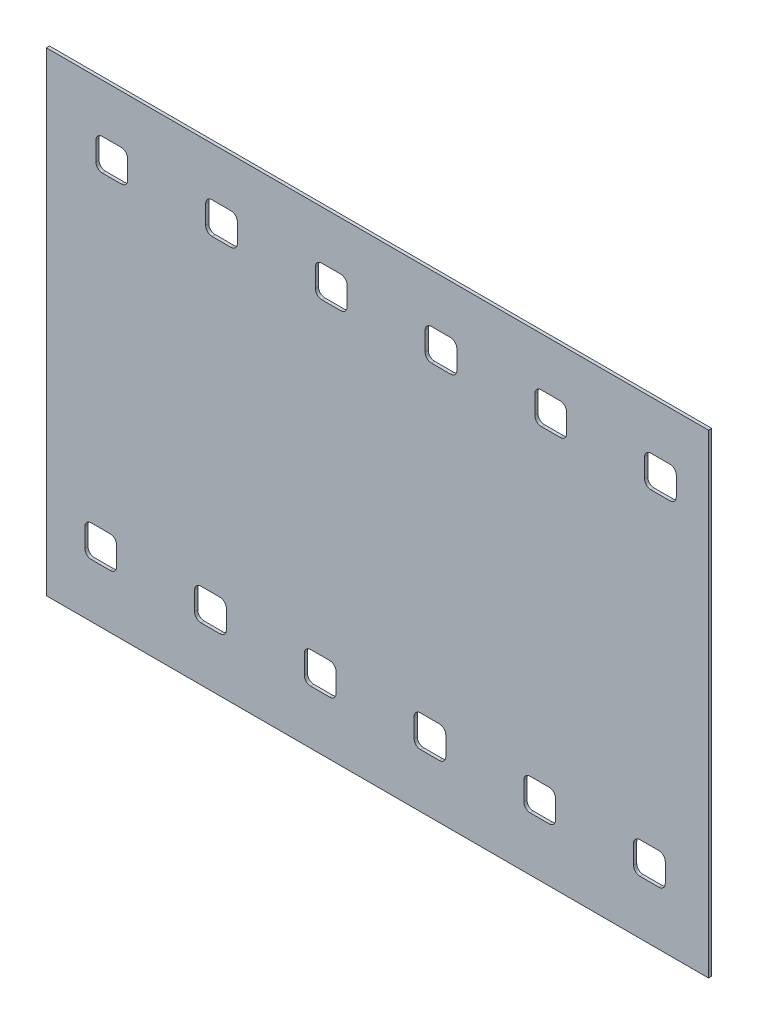
from build123d import *

# Parameters (mm, degrees)
SKETCH1_W               = 663.575
SKETCH1_H               = 475.54896
BASE_FLANGE1_DEPTH      = 3.175
CUT_EXTRUDE1_DEPTH      = 409.203048887
CUT_EXTRUDE1_DEPTH_BACK = 409.203048887


# Sheet-metal steps are written as plain solids
with BuildPart() as part:
    # Sketch1 → Base-Flange1 (new body)
    with BuildSketch(Plane.XY):
        Rectangle(SKETCH1_W, SKETCH1_H)
    extrude(amount=-BASE_FLANGE1_DEPTH)

    # Sketch6 → Cut-Extrude1 (cut, two sides: drawn at the far end of the back side and taken through both)
    with BuildSketch(Plane.XY.offset(-CUT_EXTRUDE1_DEPTH_BACK)):
        with BuildLine():
            Line((263.0805, -152.04948), (282.1305, -152.04948))
            ThreePointArc((282.1305, -152.04948), (286.620628061, -153.909351939), (288.4805, -158.39948))
            Line((288.4805, -158.39948), (288.4805, -177.44948))
            ThreePointArc((288.4805, -177.44948), (286.620628061, -181.939608061), (282.1305, -183.79948))
            Line((282.1305, -183.79948), (263.0805, -183.79948))
            ThreePointArc((263.0805, -183.79948), (258.590371939, -181.939608061), (256.7305, -177.44948))
            Line((256.7305, -177.44948), (256.7305, -158.39948))
            ThreePointArc((256.7305, -158.39948), (258.590371939, -153.909351939), (263.0805, -152.04948))
        make_face()
        with BuildLine():
            Line((153.0985, -152.04948), (172.1485, -152.04948))
            ThreePointArc((172.1485, -152.04948), (176.638628061, -153.909351939), (178.4985, -158.39948))
            Line((178.4985, -158.39948), (178.4985, -177.44948))
            ThreePointArc((178.4985, -177.44948), (176.638628061, -181.939608061), (172.1485, -183.79948))
            Line((172.1485, -183.79948), (153.0985, -183.79948))
            ThreePointArc((153.0985, -183.79948), (148.608371939, -181.939608061), (146.7485, -177.44948))
            Line((146.7485, -177.44948), (146.7485, -158.39948))
            ThreePointArc((146.7485, -158.39948), (148.608371939, -153.909351939), (153.0985, -152.04948))
        make_face()
        with BuildLine():
            Line((43.1165, -152.04948), (62.1665, -152.04948))
            ThreePointArc((62.1665, -152.04948), (66.656628061, -153.909351939), (68.5165, -158.39948))
            Line((68.5165, -158.39948), (68.5165, -177.44948))
            ThreePointArc((68.5165, -177.44948), (66.656628061, -181.939608061), (62.1665, -183.79948))
            Line((62.1665, -183.79948), (43.1165, -183.79948))
            ThreePointArc((43.1165, -183.79948), (38.626371939, -181.939608061), (36.7665, -177.44948))
            Line((36.7665, -177.44948), (36.7665, -158.39948))
            ThreePointArc((36.7665, -158.39948), (38.626371939, -153.909351939), (43.1165, -152.04948))
        make_face()
        with BuildLine():
            Line((-66.8655, -152.04948), (-47.8155, -152.04948))
            ThreePointArc((-47.8155, -152.04948), (-43.325371939, -153.909351939), (-41.4655, -158.39948))
            Line((-41.4655, -158.39948), (-41.4655, -177.44948))
            ThreePointArc((-41.4655, -177.44948), (-43.325371939, -181.939608061), (-47.8155, -183.79948))
            Line((-47.8155, -183.79948), (-66.8655, -183.79948))
            ThreePointArc((-66.8655, -183.79948), (-71.355628061, -181.939608061), (-73.2155, -177.44948))
            Line((-73.2155, -177.44948), (-73.2155, -158.39948))
            ThreePointArc((-73.2155, -158.39948), (-71.355628061, -153.909351939), (-66.8655, -152.04948))
        make_face()
        with BuildLine():
            Line((-176.8475, -152.04948), (-157.7975, -152.04948))
            ThreePointArc((-157.7975, -152.04948), (-153.307371939, -153.909351939), (-151.4475, -158.39948))
            Line((-151.4475, -158.39948), (-151.4475, -177.44948))
            ThreePointArc((-151.4475, -177.44948), (-153.307371939, -181.939608061), (-157.7975, -183.79948))
            Line((-157.7975, -183.79948), (-176.8475, -183.79948))
            ThreePointArc((-176.8475, -183.79948), (-181.337628061, -181.939608061), (-183.1975, -177.44948))
            Line((-183.1975, -177.44948), (-183.1975, -158.39948))
            ThreePointArc((-183.1975, -158.39948), (-181.337628061, -153.909351939), (-176.8475, -152.04948))
        make_face()
        with BuildLine():
            Line((-286.8295, -152.04948), (-267.7795, -152.04948))
            ThreePointArc((-267.7795, -152.04948), (-263.289371939, -153.909351939), (-261.4295, -158.39948))
            Line((-261.4295, -158.39948), (-261.4295, -177.44948))
            ThreePointArc((-261.4295, -177.44948), (-263.289371939, -181.939608061), (-267.7795, -183.79948))
            Line((-267.7795, -183.79948), (-286.8295, -183.79948))
            ThreePointArc((-286.8295, -183.79948), (-291.319628061, -181.939608061), (-293.1795, -177.44948))
            Line((-293.1795, -177.44948), (-293.1795, -158.39948))
            ThreePointArc((-293.1795, -158.39948), (-291.319628061, -153.909351939), (-286.8295, -152.04948))
        make_face()
        with BuildLine():
            Line((-275.7805, 188.87948), (-256.7305, 188.87948))
            ThreePointArc((-256.7305, 188.87948), (-252.240371939, 187.019608061), (-250.3805, 182.52948))
            Line((-250.3805, 182.52948), (-250.3805, 163.47948))
            ThreePointArc((-250.3805, 163.47948), (-252.240371939, 158.989351939), (-256.7305, 157.12948))
            Line((-256.7305, 157.12948), (-275.7805, 157.12948))
            ThreePointArc((-275.7805, 157.12948), (-280.270628061, 158.989351939), (-282.1305, 163.47948))
            Line((-282.1305, 163.47948), (-282.1305, 182.52948))
            ThreePointArc((-282.1305, 182.52948), (-280.270628061, 187.019608061), (-275.7805, 188.87948))
        make_face()
        with BuildLine():
            Line((-165.7985, 188.87948), (-146.7485, 188.87948))
            ThreePointArc((-146.7485, 188.87948), (-142.258371939, 187.019608061), (-140.3985, 182.52948))
            Line((-140.3985, 182.52948), (-140.3985, 163.47948))
            ThreePointArc((-140.3985, 163.47948), (-142.258371939, 158.989351939), (-146.7485, 157.12948))
            Line((-146.7485, 157.12948), (-165.7985, 157.12948))
            ThreePointArc((-165.7985, 157.12948), (-170.288628061, 158.989351939), (-172.1485, 163.47948))
            Line((-172.1485, 163.47948), (-172.1485, 182.52948))
            ThreePointArc((-172.1485, 182.52948), (-170.288628061, 187.019608061), (-165.7985, 188.87948))
        make_face()
        with BuildLine():
            Line((-55.8165, 188.87948), (-36.7665, 188.87948))
            ThreePointArc((-36.7665, 188.87948), (-32.276371939, 187.019608061), (-30.4165, 182.52948))
            Line((-30.4165, 182.52948), (-30.4165, 163.47948))
            ThreePointArc((-30.4165, 163.47948), (-32.276371939, 158.989351939), (-36.7665, 157.12948))
            Line((-36.7665, 157.12948), (-55.8165, 157.12948))
            ThreePointArc((-55.8165, 157.12948), (-60.306628061, 158.989351939), (-62.1665, 163.47948))
            Line((-62.1665, 163.47948), (-62.1665, 182.52948))
            ThreePointArc((-62.1665, 182.52948), (-60.306628061, 187.019608061), (-55.8165, 188.87948))
        make_face()
        with BuildLine():
            Line((54.1655, 188.87948), (73.2155, 188.87948))
            ThreePointArc((73.2155, 188.87948), (77.705628061, 187.019608061), (79.5655, 182.52948))
            Line((79.5655, 182.52948), (79.5655, 163.47948))
            ThreePointArc((79.5655, 163.47948), (77.705628061, 158.989351939), (73.2155, 157.12948))
            Line((73.2155, 157.12948), (54.1655, 157.12948))
            ThreePointArc((54.1655, 157.12948), (49.675371939, 158.989351939), (47.8155, 163.47948))
            Line((47.8155, 163.47948), (47.8155, 182.52948))
            ThreePointArc((47.8155, 182.52948), (49.675371939, 187.019608061), (54.1655, 188.87948))
        make_face()
        with BuildLine():
            Line((164.1475, 188.87948), (183.1975, 188.87948))
            ThreePointArc((183.1975, 188.87948), (187.687628061, 187.019608061), (189.5475, 182.52948))
            Line((189.5475, 182.52948), (189.5475, 163.47948))
            ThreePointArc((189.5475, 163.47948), (187.687628061, 158.989351939), (183.1975, 157.12948))
            Line((183.1975, 157.12948), (164.1475, 157.12948))
            ThreePointArc((164.1475, 157.12948), (159.657371939, 158.989351939), (157.7975, 163.47948))
            Line((157.7975, 163.47948), (157.7975, 182.52948))
            ThreePointArc((157.7975, 182.52948), (159.657371939, 187.019608061), (164.1475, 188.87948))
        make_face()
        with BuildLine():
            Line((274.1295, 188.87948), (293.1795, 188.87948))
            ThreePointArc((293.1795, 188.87948), (297.669628061, 187.019608061), (299.5295, 182.52948))
            Line((299.5295, 182.52948), (299.5295, 163.47948))
            ThreePointArc((299.5295, 163.47948), (297.669628061, 158.989351939), (293.1795, 157.12948))
            Line((293.1795, 157.12948), (274.1295, 157.12948))
            ThreePointArc((274.1295, 157.12948), (269.639371939, 158.989351939), (267.7795, 163.47948))
            Line((267.7795, 163.47948), (267.7795, 182.52948))
            ThreePointArc((267.7795, 182.52948), (269.639371939, 187.019608061), (274.1295, 188.87948))
        make_face()
    extrude(amount=CUT_EXTRUDE1_DEPTH + CUT_EXTRUDE1_DEPTH_BACK, mode=Mode.SUBTRACT)


solid = part.part
